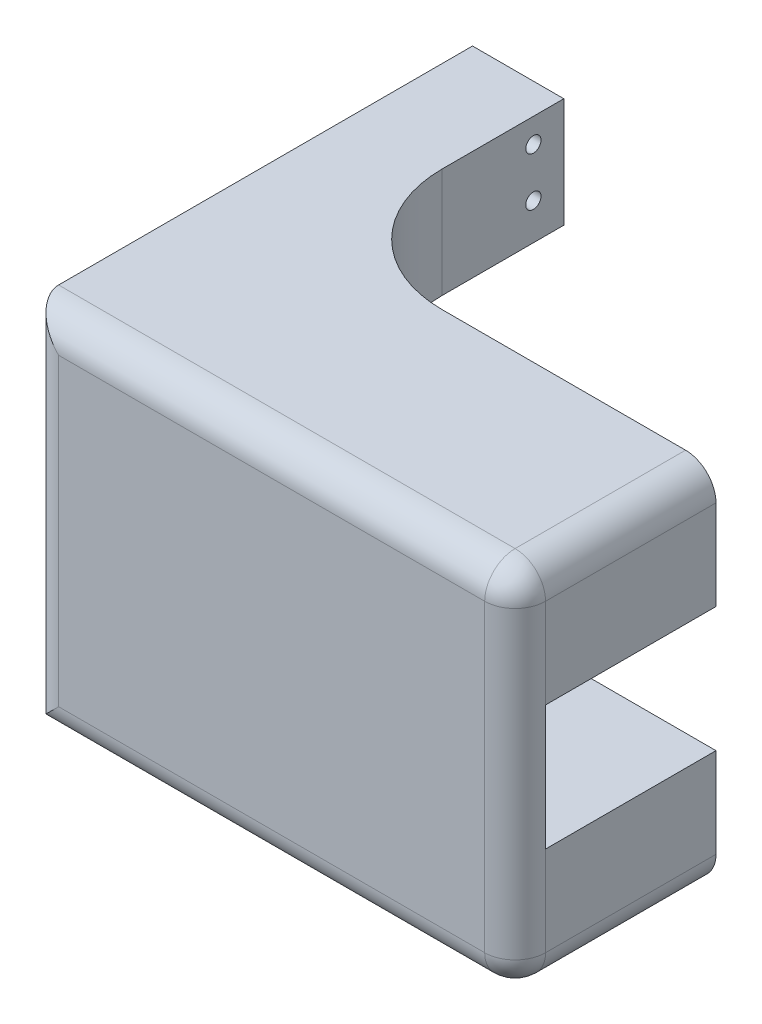
from build123d import *

# Parameters (mm, degrees)
SKETCH_2_W          = 80
SKETCH_2_H          = 60
EXTRUDE_2_DEPTH     = 33
SKETCH_3_W          = 40.7
SKETCH_3_H          = 20.5
CUT_EXTRUDE_1_DEPTH = 28
SKETCH_4_W          = 19.65
SKETCH_4_H          = 20.5
EXTRUDE_3_DEPTH     = 28
SKETCH_5_W          = 19.65
SKETCH_5_H          = 20.5
CUT_EXTRUDE_4_DEPTH = 28
SKETCH_10_W         = 15
SKETCH_10_H         = 18
EXTRUDE_6_DEPTH     = 40
M3X0_5_1_D          = 2.5
FILLET_2_R          = 20
FILLET_START        = -41
FILLET_7_DEPTH      = 81
FILLET_START_2      = -31
FILLET_7_2_DEPTH    = 62
FILLET_8_R          = 5
FILLET_10_R         = 1


with BuildPart() as part:
    # ｽｹｯﾁ2 → ﾎﾞｽ - 押し出し2 (new body)
    with BuildSketch(Plane.XY):
        Rectangle(SKETCH_2_W, SKETCH_2_H)
    extrude(amount=EXTRUDE_2_DEPTH)

    # ｽｹｯﾁ3 → ｶｯﾄ - 押し出し1 (cut)
    with BuildSketch(Plane.XY):
        Rectangle(SKETCH_3_W, SKETCH_3_H)
    extrude(amount=CUT_EXTRUDE_1_DEPTH, mode=Mode.SUBTRACT)

    # ｽｹｯﾁ4 → ﾎﾞｽ - 押し出し3 (add)
    with BuildSketch(Plane.XY):
        with Locations((30.175, 0)):
            Rectangle(SKETCH_4_W, SKETCH_4_H)
    extrude(amount=EXTRUDE_3_DEPTH)

    # ｽｹｯﾁ5 → ｶｯﾄ - 押し出し4 (cut)
    with BuildSketch(Plane.XY):
        with Locations((30.175, 0)):
            Rectangle(SKETCH_5_W, SKETCH_5_H)
    extrude(amount=CUT_EXTRUDE_4_DEPTH, mode=Mode.SUBTRACT)

    # ｽｹｯﾁ10 → ﾎﾞｽ - 押し出し6 (add)
    with BuildSketch(Plane.XY):
        with Locations((-32.5, 21)):
            Rectangle(SKETCH_10_W, SKETCH_10_H)
        with Locations((-32.5, -21)):
            Rectangle(SKETCH_10_W, SKETCH_10_H)
    extrude(amount=-EXTRUDE_6_DEPTH)

    # M3x0.5 ねじ穴1 (through all)
    with Locations(Plane(origin=(-25, 0, 0), x_dir=(0, 0, -1), z_dir=(1, 0, 0))):
        with Locations((35, 18), (35, -18), (35, 26), (35, -26)):
            Hole(M3X0_5_1_D / 2)

    # ﾌｨﾚｯﾄ2
    fillet_2_edges = [part.edges().sort_by_distance(p)[0] for p in [
        (-25, 21, 0),
        (-25, -21, 0),
    ]]
    fillet(fillet_2_edges, radius=FILLET_2_R)

    # ﾌｨﾚｯﾄ7: read off the stored shape, not the designer's step
    # ﾌｨﾚｯﾄ7 outline → ﾌｨﾚｯﾄ7 (cut)
    with BuildSketch(Plane.YZ.offset(FILLET_START)):
        with BuildLine():
            ThreePointArc((-30, 28), (-28.535533906, 31.535533906), (-25, 33))
            Line((-25, 33), (-30, 33))
            Line((-30, 33), (-30, 28))
        make_face()
        with BuildLine():
            ThreePointArc((25, 33), (28.535533906, 31.535533906), (30, 28))
            Line((30, 28), (30, 33))
            Line((30, 33), (25, 33))
        make_face()
    extrude(amount=FILLET_7_DEPTH, mode=Mode.SUBTRACT)

    # Fillet 7 2 outline → Fillet 7 2 (cut)
    with BuildSketch(Plane(origin=(0, 0, 0), x_dir=(1, 0, 0), z_dir=(0, 1, 0)).offset(FILLET_START_2)):
        with BuildLine():
            ThreePointArc((40, -28), (38.535533906, -31.535533906), (35, -33))
            Line((35, -33), (40, -33))
            Line((40, -33), (40, -28))
        make_face()
        with BuildLine():
            ThreePointArc((-35, -33), (-38.535533906, -31.535533906), (-40, -28))
            Line((-40, -28), (-40, -33))
            Line((-40, -33), (-35, -33))
        make_face()
    extrude(amount=FILLET_7_2_DEPTH, mode=Mode.SUBTRACT)

    # ﾌｨﾚｯﾄ8
    # the kernel refuses this fillet: 5 mm, written as the material it takes off along each edge
    with BuildSketch(Plane(origin=(35, 25, 28), x_dir=(1, 0, 0), z_dir=(0, 1, 0))) as fillet_8_piece_1_section:
        Polygon((0, 0), (FILLET_8_R, 0), (FILLET_8_R, -FILLET_8_R), (0, -FILLET_8_R), align=None)
    fillet_8_piece_1 = extrude(amount=FILLET_8_R, mode=Mode.PRIVATE)
    fillet_8_piece_1 = fillet_8_piece_1 - Plane(origin=(35, 25, 28), x_dir=(-0.7071067811865475, 0, -0.7071067811865475), z_dir=(0, 1, 0)) * Sphere(FILLET_8_R, mode=Mode.PRIVATE)
    add(fillet_8_piece_1, mode=Mode.SUBTRACT)
    with BuildSketch(Plane(origin=(35, -25, 28), x_dir=(0, -1, 0), z_dir=(1, 0, 0))) as fillet_8_piece_2_section:
        Polygon((0, 0), (FILLET_8_R, 0), (FILLET_8_R, -FILLET_8_R), (0, -FILLET_8_R), align=None)
    fillet_8_piece_2 = extrude(amount=FILLET_8_R, mode=Mode.PRIVATE)
    fillet_8_piece_2 = fillet_8_piece_2 - Plane(origin=(35, -25, 28), x_dir=(0, 0.7071067811865475, -0.7071067811865475), z_dir=(1, 0, 0)) * Sphere(FILLET_8_R, mode=Mode.PRIVATE)
    add(fillet_8_piece_2, mode=Mode.SUBTRACT)
    with BuildSketch(Plane(origin=(40, -30, -12.5), x_dir=(0, 1, 0), z_dir=(0, 0, 1)), Plane(origin=(40, 30, -12.5), x_dir=(-1, 0, 0), z_dir=(0, 0, 1))) as fillet_8_piece_3:
        with BuildLine():
            CenterArc((FILLET_8_R, FILLET_8_R), FILLET_8_R, 180, 90)
            Line((0, FILLET_8_R), (0, 0))
            Line((0, 0), (FILLET_8_R, 0))
        make_face()
    extrude(amount=40.5, mode=Mode.SUBTRACT)

    # ﾌｨﾚｯﾄ10
    fillet_10_edges = [part.edges().sort_by_distance(p)[0] for p in [
        (-22.5, 12, 0),
        (-22.5, -12, 0),
    ]]
    fillet(fillet_10_edges, radius=FILLET_10_R)


solid = part.part
